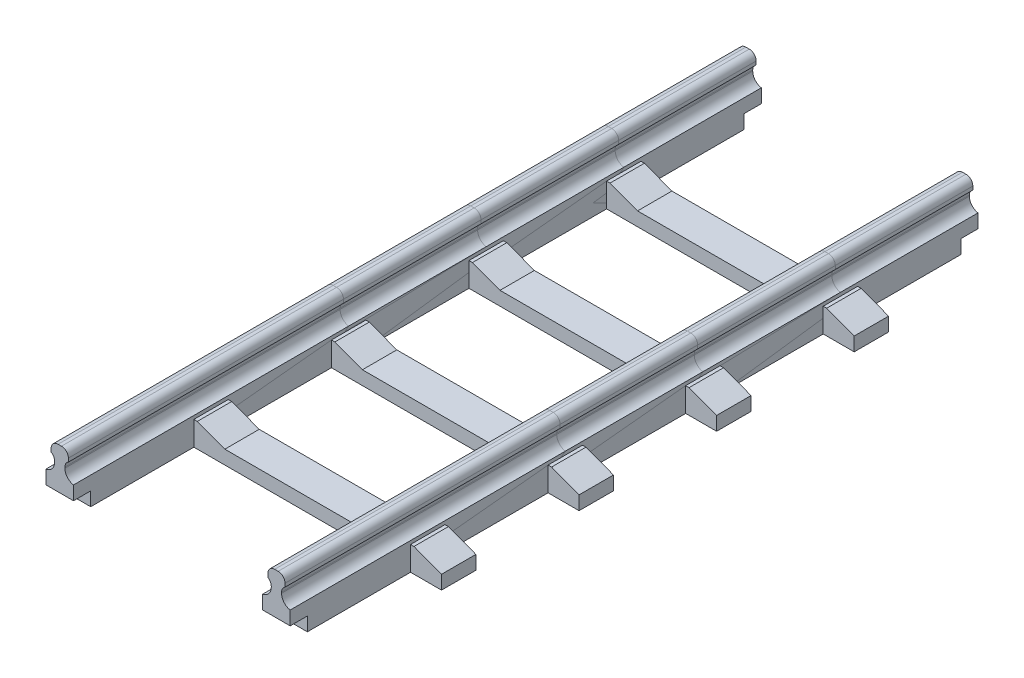
from build123d import *

# Parameters (mm, degrees)
SKETCH_1_W             = 4
SKETCH_1_H             = 17.5
SKETCH_1_H_2           = 5
EXTRUDE_1_DEPTH        = 4
SKETCH_1_7_W           = 44.5
SKETCH_1_7_H           = 5
EXTRUDE_2_DEPTH        = 3.5
SKETCH_2_W             = 18.5
SKETCH_2_H             = 1.5
CUT_EXTRUDE_1_DEPTH    = 32.89533665
SKETCH_2_3_W           = 2.5
SKETCH_2_3_H           = 1.5
EXTRUDE_4_DEPTH        = 22.5
FILLET_1_R             = 1
FILLET_2_R             = 1.5
FILLET_3_R             = 1
SKETCH_5_W             = 2.5
SKETCH_5_H             = 2
CUT_EXTRUDE_2_DEPTH    = 43.315038698
SKETCH_10_R            = 0.4
CUT_EXTRUDE_3_DEPTH    = 2
PATTERN_LINEAR_2_COUNT = 4
PATTERN_LINEAR_2_PITCH = 20


with BuildPart() as part:
    # 草图1 → 凸台-拉伸1 (new body)
    with BuildSketch(Plane(origin=(0, 0, 0), x_dir=(1, 0, 0), z_dir=(0, 1, 0))):
        with Locations((-15.75, -2.5)):
            Rectangle(SKETCH_1_W, SKETCH_1_H)
        with Locations((15.75, -2.5)):
            Rectangle(SKETCH_1_W, SKETCH_1_H)
        with Locations((15.75, 8.75)):
            Rectangle(SKETCH_1_W, SKETCH_1_H_2)
        with Locations((-15.75, 8.75)):
            Rectangle(SKETCH_1_W, SKETCH_1_H_2)
    extrude(amount=EXTRUDE_1_DEPTH)

    # 草图1<7> → 凸台-拉伸2 (add)
    with BuildSketch(Plane(origin=(0, 0, 0), x_dir=(1, 0, 0), z_dir=(0, 1, 0))):
        with Locations((0, 8.75)):
            Rectangle(SKETCH_1_7_W, SKETCH_1_7_H)
    extrude(amount=EXTRUDE_2_DEPTH)

    # 草图2 → 切除-拉伸1 (cut, through all)
    with BuildSketch(Plane(origin=(0, 0, -11.25), x_dir=(-1, 0, 0), z_dir=(0, 0, -1))):
        with Locations((0, 2.75)):
            Rectangle(SKETCH_2_W, SKETCH_2_H)
        Polygon((13.25, 3.5), (9.25, 3.5), (9.25, 2), align=None)
        Polygon((-9.25, 3.5), (-13.25, 3.5), (-9.25, 2), align=None)
        Polygon((-22.25, 3.5), (-22.25, 2), (-18.25, 3.5), align=None)
        Polygon((22.25, 3.5), (18.25, 3.5), (22.25, 2), align=None)
    extrude(amount=-CUT_EXTRUDE_1_DEPTH, mode=Mode.SUBTRACT)

    # 草图2<3> → 凸台-拉伸4 (add, through all)
    with BuildSketch(Plane(origin=(0, 0, -11.25), x_dir=(-1, 0, 0), z_dir=(0, 0, -1))):
        with Locations((-15.75, 7.25)):
            Rectangle(SKETCH_2_3_W, SKETCH_2_3_H)
        Polygon((-15, 6.5), (-16.5, 6.5), (-16.5, 4), (-15.75, 4), (-15, 4), align=None)
        with Locations((15.75, 7.25)):
            Rectangle(SKETCH_2_3_W, SKETCH_2_3_H)
        Polygon((16.5, 6.5), (15, 6.5), (15, 4), (15.75, 4), (16.5, 4), align=None)
    extrude(amount=-EXTRUDE_4_DEPTH)

    # 圆角1
    # the kernel refuses this fillet: 1 mm, written as the material it adds along each edge
    with BuildSketch(Plane(origin=(-16.5, 6.5, -11.25), x_dir=(0, -1, 0), z_dir=(0, 0, 1))) as fillet_1_piece_1:
        with BuildLine():
            CenterArc((0.866025404, -1), FILLET_1_R, 90, 60)
            Line((0, -0.5), (-0.017320508, -0.49))
            ThreePointArc((-0.017320508, -0.49), (-0.02, -0.25), (-0.02, 0))
            Line((-0.02, 0), (0, 0.02))
            Line((0, 0.02), (0.866025404, 0.02))
            Line((0.866025404, 0.02), (0.866025404, 0))
        make_face()
    extrude(amount=22.5)
    with BuildSketch(Plane(origin=(-15, 6.5, -11.25), x_dir=(0, -1, 0), z_dir=(0, 0, 1)), Plane(origin=(16.5, 6.5, -11.25), x_dir=(0, -1, 0), z_dir=(0, 0, 1))) as fillet_1_piece_2:
        with BuildLine():
            CenterArc((0.866025404, 1), FILLET_1_R, 210, 60)
            Line((0, 0.5), (-0.017320508, 0.49))
            ThreePointArc((-0.017320508, 0.49), (-0.02, 0.25), (-0.02, 0))
            Line((-0.02, 0), (0, -0.02))
            Line((0, -0.02), (0.866025404, -0.02))
            Line((0.866025404, -0.02), (0.866025404, 0))
        make_face()
    extrude(amount=22.5)
    with BuildSketch(Plane(origin=(15, 6.5, -11.25), x_dir=(-1, 0, 0), z_dir=(0, 0, 1))) as fillet_1_piece_3:
        with BuildLine():
            CenterArc((1, 0.866025404), FILLET_1_R, 180, 60)
            Line((0, 0.866025404), (-0.02, 0.866025404))
            Line((-0.02, 0.866025404), (-0.02, 0))
            Line((-0.02, 0), (0, -0.02))
            ThreePointArc((0, -0.02), (0.25, -0.02), (0.49, -0.017320508))
            Line((0.49, -0.017320508), (0.5, 0))
        make_face()
    extrude(amount=22.5)

    # 圆角2
    # the kernel refuses this fillet: 1.5 mm, written as the material it adds along each edge
    with BuildSketch(Plane(origin=(16.5, 4, -11.25), x_dir=(1, 0, 0), z_dir=(0, 0, 1)), Plane(origin=(-15, 4, -11.25), x_dir=(1, 0, 0), z_dir=(0, 0, 1))) as fillet_2_piece_1:
        with BuildLine():
            CenterArc((1.5, 1.479019946), FILLET_2_R, 180, 80.405931773)
            Line((0, 1.479019946), (-0.03, 1.479019946))
            Line((-0.03, 1.479019946), (-0.03, 0))
            Line((-0.03, 0), (0, -0.03))
            ThreePointArc((0, -0.03), (0.625, -0.03), (1.245, -0.029580399))
            Line((1.245, -0.029580399), (1.25, 0))
        make_face()
    extrude(amount=22.5)
    with BuildSketch(Plane(origin=(15, 4, -11.25), x_dir=(0, 1, 0), z_dir=(0, 0, 1)), Plane(origin=(-16.5, 4, -11.25), x_dir=(0, 1, 0), z_dir=(0, 0, 1))) as fillet_2_piece_2:
        with BuildLine():
            CenterArc((1.479019946, 1.5), FILLET_2_R, 189.594068227, 80.405931773)
            Line((0, 1.25), (-0.029580399, 1.245))
            ThreePointArc((-0.029580399, 1.245), (-0.03, 0.625), (-0.03, 0))
            Line((-0.03, 0), (0, -0.03))
            Line((0, -0.03), (1.479019946, -0.03))
            Line((1.479019946, -0.03), (1.479019946, 0))
        make_face()
    extrude(amount=22.5)

    # 圆角3
    fillet_3_edges = [part.edges().sort_by_distance(p)[0] for p in [
        (14.5, 8, 0),
        (17, 8, 0),
        (-17, 8, 0),
        (-14.5, 8, 0),
    ]]
    fillet(fillet_3_edges, radius=FILLET_3_R)

    # 草图5 → 切除-拉伸2 (cut, through all)
    with BuildSketch(Plane(origin=(17.75, 0, 0), x_dir=(0, 0, -1), z_dir=(1, 0, 0))):
        with Locations((-10, 1)):
            Rectangle(SKETCH_5_W, SKETCH_5_H)
    extrude(amount=-CUT_EXTRUDE_2_DEPTH, mode=Mode.SUBTRACT)

    # 草图10 → 切除-拉伸3 (cut)
    with BuildSketch(Plane.XZ.offset(-2)):
        with Locations(Location((15.75, 10, 0), (0, 0, 270))):
            Circle(SKETCH_10_R)
        with Locations(Location((-15.75, 10, 0), (0, 0, 270))):
            Circle(SKETCH_10_R)
    extrude(amount=-CUT_EXTRUDE_3_DEPTH, mode=Mode.SUBTRACT)

    # 镜向1: part across plane


with BuildPart() as part_1:
    add(part.part)
    add(part.part.mirror(Plane(origin=(0, 0, -8.75), x_dir=(1, 0, 0), z_dir=(0, 0, -1))))


with BuildPart() as pattern_linear_2_1:
    # 阵列(线性)2: pattern copy
    add(part_1.part.moved(Location(Vector(0, 0, -1) * (1 * PATTERN_LINEAR_2_PITCH))))


with BuildPart() as pattern_linear_2_2:
    # 阵列(线性)2: pattern copy
    add(part_1.part.moved(Location(Vector(0, 0, -1) * (2 * PATTERN_LINEAR_2_PITCH))))


with BuildPart() as pattern_linear_2_3:
    # 阵列(线性)2: pattern copy
    add(part_1.part.moved(Location(Vector(0, 0, -1) * (3 * PATTERN_LINEAR_2_PITCH))))


solid = Compound([part_1.part, pattern_linear_2_1.part, pattern_linear_2_2.part, pattern_linear_2_3.part])
